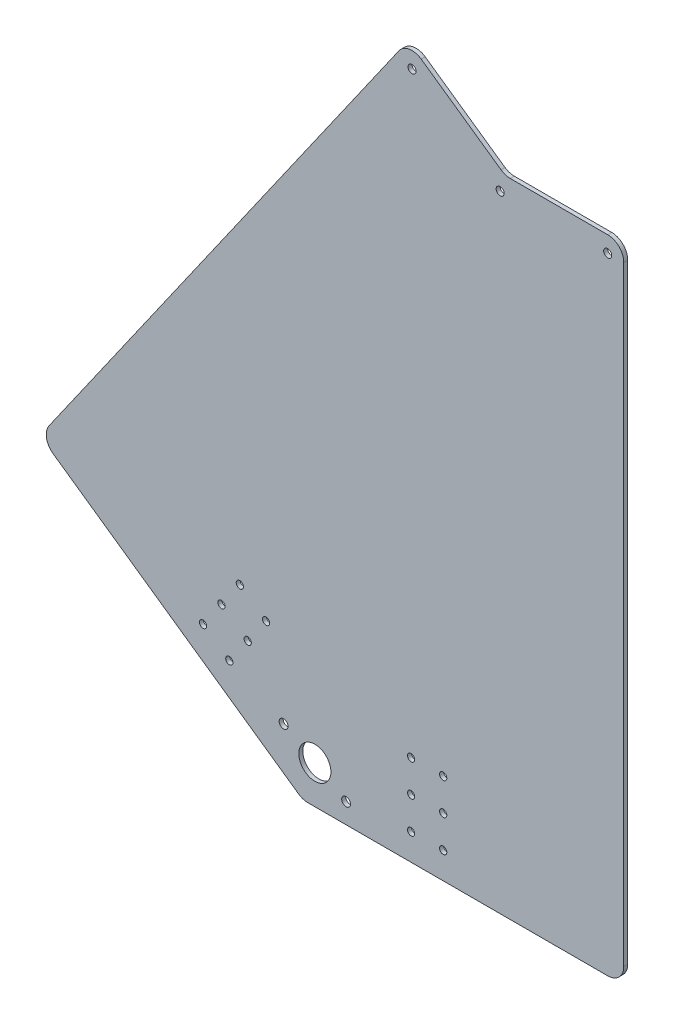
from build123d import *

# Parameters (mm, degrees)
BASE_FLANGE1_DEPTH         = 5
FILLET1_R                  = 20
F_10_0_10_DIAMETER_HOLE1_D = 10
SKETCH10_R                 = 20
CUT_EXTRUDE1_DEPTH         = 964.833217765
M10_CLEARANCE_HOLE3_D      = 11
M8_CLEARANCE_HOLE1_D       = 9


# Sheet-metal steps are written as plain solids
with BuildPart() as part:
    # Sketch1 → Base-Flange1 (new body)
    with BuildSketch(Plane.XY):
        Polygon((0, 0), (400, 0), (400, 800), (252.239031103, 800), (131.200331365, 884.752209972), (-327.660817716, 229.43057454), align=None)
    extrude(amount=-BASE_FLANGE1_DEPTH)

    # Fillet1
    fillet1_edges = [part.edges().sort_by_distance(p)[0] for p in [
        (-327.660817716, 229.43057454, -2.5),
        (131.200331365, 884.752209972, -2.5),
        (252.239031103, 800, -2.5),
        (400, 800, -2.5),
        (400, 0, -2.5),
        (0, 0, -2.5),
    ]]
    fillet(fillet1_edges, radius=FILLET1_R)

    # Ø10.0 (10) Diameter Hole1 (through all)
    with Locations(Plane.XY):
        with Locations((245.933055326, 780), (136.111843524, 856.897640359), (380, 780)):
            Hole(F_10_0_10_DIAMETER_HOLE1_D / 2)

    # Sketch10 → Cut-Extrude1 (cut, through all)
    with BuildSketch(Plane.XY):
        with Locations((14.976692472, 47.5)):
            Circle(SKETCH10_R)
    extrude(amount=-CUT_EXTRUDE1_DEPTH, mode=Mode.SUBTRACT)

    # M10 Clearance Hole3 (through all)
    with Locations(Plane.XY):
        with Locations((-23.994450699, 70), (53.947835642, 25)):
            Hole(M10_CLEARANCE_HOLE3_D / 2)

    # M8 Clearance Hole1 (through all)
    with Locations(Plane.XY):
        with Locations((-124.404492942, 127.394525174), (-78.518378033, 192.926688717), (-45.752296262, 169.983631263), (-91.63841117, 104.45146772), (-101.461435488, 160.160606946), (-68.695353716, 137.217549491), (134.976692472, 113), (174.976692472, 33), (134.976692472, 33), (174.976692472, 113), (134.976692472, 73), (174.976692472, 73)):
            Hole(M8_CLEARANCE_HOLE1_D / 2)


solid = part.part
